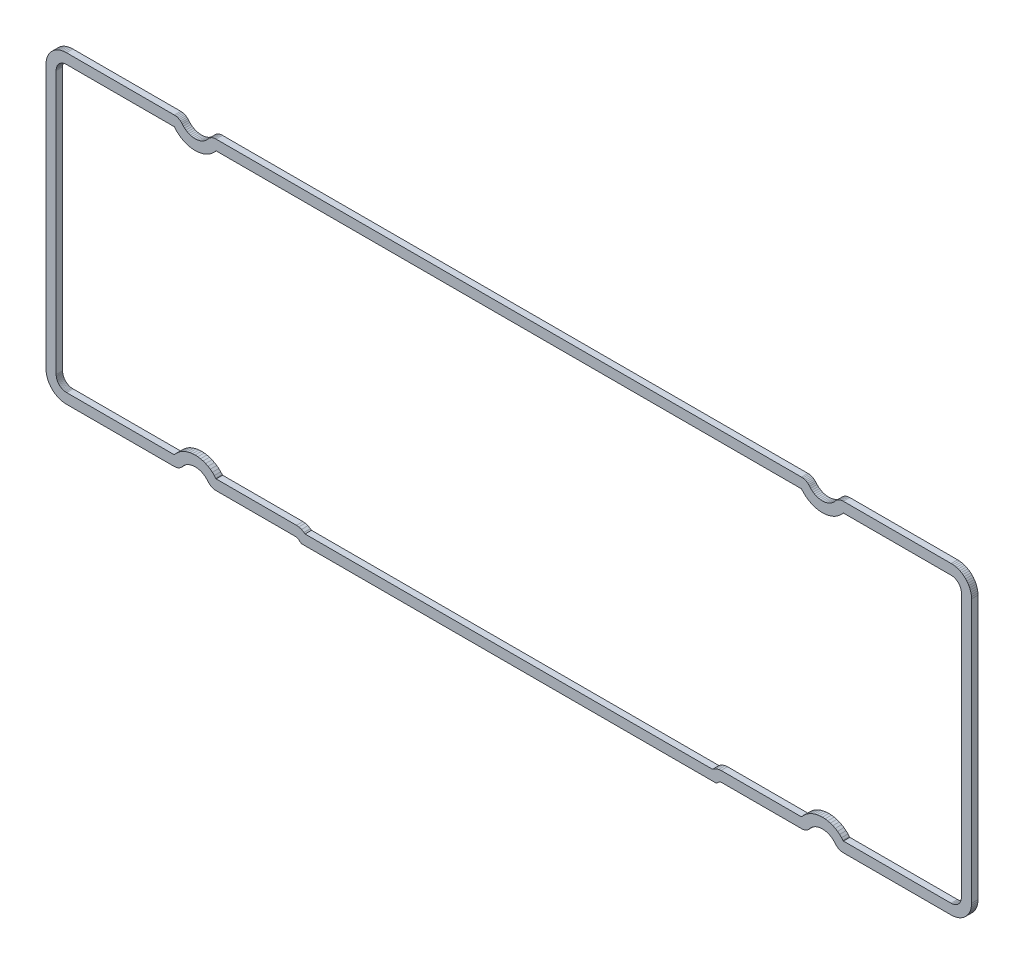
from build123d import *

# Parameters (mm, degrees)
BOSS_EXTRUDE1_DEPTH     = 1.58
CUT_EXTRUDE1_DEPTH      = 241.275220112
CUT_EXTRUDE1_DEPTH_BACK = 241.275220112


# Read off the part's stored shape, not the designer's step: Imported1
with BuildPart() as part:
    # Sketch1 → Boss-Extrude1 (new body)
    with BuildSketch(Plane.XY.offset(1.58)):
        Polygon((32.226525, -0.75), (5.75, -0.75), (5.314221, -0.769021), (4.881758, -0.825955), (4.455903, -0.920364), (4.039897, -1.05153), (3.636906, -1.218454), (3.249996, -1.419866), (2.882114, -1.654233), (2.536058, -1.919771), (2.214461, -2.21446), (1.919773, -2.536056), (1.654235, -2.882113), (1.419868, -3.249996), (1.218457, -3.636905), (1.051533, -4.039897), (0.920368, -4.455903), (0.825959, -4.881758), (0.769025, -5.314221), (0.75, -5.75), (0.75, -70.45), (0.769049, -70.885778), (0.825982, -71.31824), (0.92039, -71.744094), (1.051554, -72.160099), (1.218476, -72.563089), (1.419886, -72.949998), (1.654251, -73.31788), (1.919788, -73.663936), (2.214475, -73.985532), (2.53607, -74.280221), (2.882124, -74.545759), (3.250005, -74.780126), (3.636913, -74.981538), (4.039903, -75.148463), (4.455907, -75.279629), (4.881761, -75.374039), (5.314222, -75.430973), (5.75, -75.45), (32.226525, -75.45), (32.549874, -75.429018), (32.867789, -75.366362), (33.174932, -75.263117), (33.466142, -75.121016), (33.736529, -74.942447), (33.981551, -74.730408), (34.197092, -74.488462), (34.461021, -74.18345), (34.754326, -73.906568), (35.074025, -73.660633), (35.416866, -73.448144), (35.779364, -73.271264), (36.157832, -73.131789), (36.548422, -73.031139), (36.947163, -72.970336), (37.35, -72.95), (37.752837, -72.970336), (38.151578, -73.031139), (38.542168, -73.131789), (38.920636, -73.271264), (39.283134, -73.448144), (39.625975, -73.660633), (39.945674, -73.906568), (40.238979, -74.18345), (40.502908, -74.488462), (40.718455, -74.730406), (40.963468, -74.942455), (41.233851, -75.12103), (41.525061, -75.26313), (41.832206, -75.366368), (42.150125, -75.429009), (42.473475, -75.45), (62.085786, -75.45), (62.280875, -75.469228), (62.468467, -75.52613), (62.641355, -75.618535), (62.792893, -75.742893), (63.007107, -75.957107), (63.158642, -76.081473), (63.331529, -76.173883), (63.519123, -76.230787), (63.714214, -76.25), (164.885786, -76.25), (165.080877, -76.230785), (165.26847, -76.173881), (165.441357, -76.081471), (165.592893, -75.957107), (165.807107, -75.742893), (165.958636, -75.618521), (166.131526, -75.526114), (166.319122, -75.469212), (166.514214, -75.45), (186.126525, -75.45), (186.449876, -75.429027), (186.767795, -75.366378), (187.07494, -75.263136), (187.366152, -75.121035), (187.636539, -74.942462), (187.881557, -74.730417), (188.097092, -74.488462), (188.361021, -74.18345), (188.654326, -73.906568), (188.974025, -73.660633), (189.316866, -73.448144), (189.679364, -73.271264), (190.057832, -73.131789), (190.448422, -73.031139), (190.847163, -72.970336), (191.25, -72.95), (191.652837, -72.970336), (192.051578, -73.031139), (192.442168, -73.131789), (192.820636, -73.271264), (193.183134, -73.448144), (193.525975, -73.660633), (193.845674, -73.906568), (194.138979, -74.18345), (194.402908, -74.488462), (194.618449, -74.730405), (194.863474, -74.942436), (195.133863, -75.120998), (195.425073, -75.263093), (195.732215, -75.366334), (196.050128, -75.428987), (196.373475, -75.45), (222.85, -75.45), (223.285777, -75.43099), (223.718238, -75.374048), (224.14409, -75.279632), (224.560092, -75.148461), (224.96308, -74.981533), (225.349986, -74.780118), (225.717866, -74.545749), (226.063919, -74.28021), (226.385513, -73.985521), (226.680201, -73.663925), (226.945738, -73.31787), (227.180105, -72.949989), (227.381518, -72.563082), (227.548445, -72.160094), (227.679614, -71.74409), (227.774028, -71.318238), (227.830967, -70.885777), (227.85, -70.45), (227.85, -5.75), (227.831004, -5.314218), (227.774075, -4.881752), (227.679669, -4.455893), (227.548505, -4.039884), (227.381582, -3.636889), (227.18017, -3.249977), (226.945803, -2.882092), (226.680263, -2.536033), (226.385572, -2.214435), (226.063973, -1.919746), (225.717913, -1.654208), (225.350026, -1.419842), (224.963113, -1.218432), (224.560118, -1.051511), (224.144107, -0.92035), (223.718249, -0.825946), (223.285782, -0.769018), (222.85, -0.75), (196.373475, -0.75), (196.050123, -0.771011), (195.732202, -0.833642), (195.425054, -0.936871), (195.13384, -1.078964), (194.863453, -1.257534), (194.618436, -1.46958), (194.402908, -1.711538), (194.138979, -2.01655), (193.845674, -2.293432), (193.525975, -2.539367), (193.183134, -2.751856), (192.820636, -2.928736), (192.442168, -3.068211), (192.051578, -3.168861), (191.652837, -3.229664), (191.25, -3.25), (190.847163, -3.229664), (190.448422, -3.168861), (190.057832, -3.068211), (189.679364, -2.928736), (189.316866, -2.751856), (188.974025, -2.539367), (188.654326, -2.293432), (188.361021, -2.01655), (188.097092, -1.711538), (187.881562, -1.469586), (187.636533, -1.257558), (187.366142, -1.078997), (187.07493, -0.936904), (186.767787, -0.833665), (186.449872, -0.771012), (186.126525, -0.75), (42.473475, -0.75), (42.150126, -0.771021), (41.832208, -0.833658), (41.525063, -0.93689), (41.23385, -1.078983), (40.963463, -1.257549), (40.718443, -1.469588), (40.502908, -1.711538), (40.238979, -2.01655), (39.945674, -2.293432), (39.625975, -2.539367), (39.283134, -2.751856), (38.920636, -2.928736), (38.542168, -3.068211), (38.151578, -3.168861), (37.752837, -3.229664), (37.35, -3.25), (36.947163, -3.229664), (36.548422, -3.168861), (36.157832, -3.068211), (35.779364, -2.928736), (35.416866, -2.751856), (35.074025, -2.539367), (34.754326, -2.293432), (34.461021, -2.01655), (34.197092, -1.711538), (33.981556, -1.469585), (33.73654, -1.257538), (33.466154, -1.078966), (33.174942, -0.936867), (32.867796, -0.833631), (32.549876, -0.770991), align=None)
    extrude(amount=-BOSS_EXTRUDE1_DEPTH)

    # Sketch2 → Cut-Extrude1 (cut, two sides: drawn at the far end of the back side and taken through both)
    with BuildSketch(Plane.XY.offset(1.58).offset(-CUT_EXTRUDE1_DEPTH_BACK)):
        Polygon((32.145463973, -3.25), (5.804534377, -3.25), (5.532299861, -3.261882566), (5.316287537, -3.290320711), (5.103564456, -3.337479893), (4.895760622, -3.403000096), (4.694456009, -3.486383029), (4.501186257, -3.586992595), (4.317421589, -3.704063759), (4.144557179, -3.836707232), (3.983912255, -3.983911005), (3.83671052, -4.14455375), (3.704067637, -4.317417891), (3.586995963, -4.501183859), (3.486387003, -4.694452907), (3.403004475, -4.895757044), (3.337484486, -5.103561783), (3.290324711, -5.316287537), (3.261885068, -5.532311236), (3.25, -5.804545834), (3.25, -70.395385297), (3.261900174, -70.667621856), (3.290348531, -70.883715039), (3.337507548, -71.096439128), (3.403027127, -71.304243652), (3.486408413, -71.505546203), (3.587016856, -71.698815217), (3.704085931, -71.882578174), (3.836727167, -72.05544032), (3.983930437, -72.216085285), (4.144574834, -72.363289492), (4.317435761, -72.495931059), (4.501198861, -72.613001542), (4.694468786, -72.713611718), (4.895771795, -72.796994692), (5.103573408, -72.86251451), (5.316294664, -72.909673898), (5.532318797, -72.938113729), (5.804551688, -72.95), (32.145498155, -72.95), (32.224021786, -72.94490463), (32.318401337, -72.838963047), (32.653108821, -72.452155234), (33.129964152, -72.00200042), (33.649728946, -71.602160713), (34.207119099, -71.256696558), (34.796467341, -70.969125545), (35.411777002, -70.742368421), (36.046796548, -70.578732083), (36.695068774, -70.479878702), (37.35, -70.446816492), (38.004931226, -70.479878702), (38.653203452, -70.578732083), (39.288222998, -70.742368421), (39.903532659, -70.969125545), (40.492880901, -71.256696558), (41.050271054, -71.602160713), (41.570035848, -72.00200042), (42.046891179, -72.452155234), (42.381583996, -72.838946096), (42.475978126, -72.944900219), (42.554536277, -72.95), (62.20868843, -72.95), (62.771022013, -73.005423679), (63.429755932, -73.205236451), (64.036950155, -73.529768993), (64.305315409, -73.75), (164.294671936, -73.75), (164.562942889, -73.529808518), (165.170238602, -73.205218462), (165.829082341, -73.00537664), (166.391415226, -72.95), (186.045533338, -72.95), (186.124024873, -72.944908929), (186.218374915, -72.838993581), (186.553108821, -72.452155234), (187.029964152, -72.00200042), (187.549728946, -71.602160713), (188.107119099, -71.256696558), (188.696467341, -70.969125545), (189.311777002, -70.742368421), (189.946796548, -70.578732083), (190.595068774, -70.479878702), (191.25, -70.446816492), (191.904931226, -70.479878702), (192.553203452, -70.578732083), (193.188222998, -70.742368421), (193.803532659, -70.969125545), (194.392880901, -71.256696558), (194.950271054, -71.602160713), (195.470035848, -72.00200042), (195.946891179, -72.452155234), (196.281593626, -72.838957225), (196.375965094, -72.944888422), (196.454621807, -72.95), (222.795496881, -72.95), (223.067705674, -72.938125373), (223.283664196, -72.909690185), (223.496391314, -72.862526279), (223.704199275, -72.797001647), (223.905505697, -72.713615346), (224.098777794, -72.61300202), (224.282545777, -72.495927109), (224.455409659, -72.363282392), (224.616057813, -72.216074285), (224.763264302, -72.055426352), (224.895907896, -71.882561634), (225.012982623, -71.698791873), (225.113596665, -71.505515981), (225.196982092, -71.30421046), (225.262505034, -71.096403693), (225.309667604, -70.883678092), (225.338110613, -70.667648796), (225.35, -70.395431001), (225.35, -5.804462394), (225.338132356, -5.532210049), (225.309704543, -5.316255742), (225.262548085, -5.10353619), (225.197029698, -4.895733448), (225.113648703, -4.694430308), (225.013039843, -4.501160915), (224.895969054, -4.317395337), (224.7633277, -4.144533492), (224.616125187, -3.983890535), (224.455482053, -3.836689317), (224.282619348, -3.704048685), (224.098852383, -3.586978148), (223.905582328, -3.486370203), (223.704282796, -3.402991702), (223.49647827, -3.337474566), (223.283753345, -3.290317805), (223.067730604, -3.261881548), (222.795474591, -3.25), (196.454612848, -3.25), (196.375952376, -3.255111257), (196.281643317, -3.360985349), (195.946891179, -3.747844766), (195.470035848, -4.19799958), (194.950271054, -4.597839287), (194.392880901, -4.943303442), (193.803532659, -5.230874455), (193.188222998, -5.457631579), (192.553203452, -5.621267917), (191.904931226, -5.720121298), (191.25, -5.753183508), (190.595068774, -5.720121298), (189.946796548, -5.621267917), (189.311777002, -5.457631579), (188.696467341, -5.230874455), (188.107119099, -4.943303442), (187.549728946, -4.597839287), (187.029964152, -4.19799958), (186.553108821, -3.747844766), (186.218370527, -3.361001349), (186.124044398, -3.255111701), (186.045382046, -3.25), (42.554652135, -3.25), (42.475955011, -3.25511612), (42.38161669, -3.361016121), (42.046891179, -3.747844766), (41.570035848, -4.19799958), (41.050271054, -4.597839287), (40.492880901, -4.943303442), (39.903532659, -5.230874455), (39.288222998, -5.457631579), (38.653203452, -5.621267917), (38.004931226, -5.720121298), (37.35, -5.753183508), (36.695068774, -5.720121298), (36.046796548, -5.621267917), (35.411777002, -5.457631579), (34.796467341, -5.230874455), (34.207119099, -4.943303442), (33.649728946, -4.597839287), (33.129964152, -4.19799958), (32.653108821, -3.747844766), (32.318380158, -3.361012478), (32.224031805, -3.255100394), align=None)
    extrude(amount=CUT_EXTRUDE1_DEPTH + CUT_EXTRUDE1_DEPTH_BACK, mode=Mode.SUBTRACT)


solid = part.part
